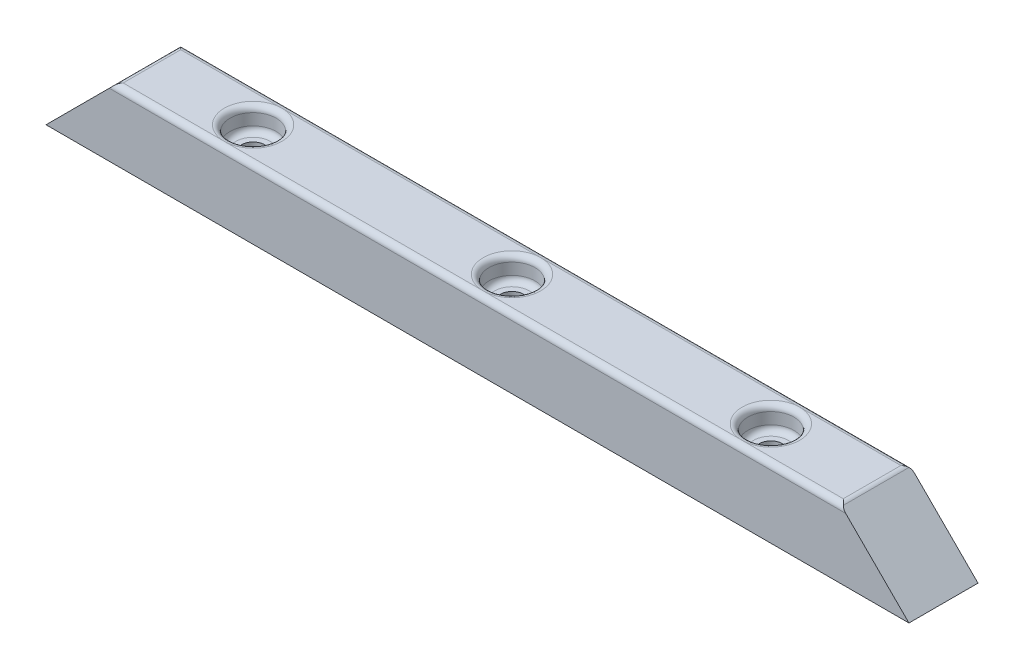
from build123d import *

# Parameters (mm, degrees)
BOSS_EXTRUDE1_DEPTH = 12
SKETCH3_R           = 2
CUT_EXTRUDE1_DEPTH  = 12
SKETCH4_R           = 4
CUT_EXTRUDE2_DEPTH  = 4
FILLET1_R           = 1
FILLET2_R           = 1
FILLET3_R           = 1


with BuildPart() as part:
    # Sketch2 → Boss-Extrude1 (new body)
    with BuildSketch(Plane.XY):
        Polygon((-75, -6), (-63, 6), (63, 6), (75, -6), align=None)
    extrude(amount=BOSS_EXTRUDE1_DEPTH)

    # Sketch3 → Cut-Extrude1 (cut)
    with BuildSketch(Plane(origin=(0, 6, 0), x_dir=(1, 0, 0), z_dir=(0, 1, 0))):
        with Locations(Location((0, -6, 0), (0, 0, 180))):
            Circle(SKETCH3_R)
        with Locations(Location((45, -6, 0), (0, 0, 180))):
            Circle(SKETCH3_R)
        with Locations(Location((-45, -6, 0), (0, 0, 180))):
            Circle(SKETCH3_R)
    extrude(amount=-CUT_EXTRUDE1_DEPTH, mode=Mode.SUBTRACT)

    # Sketch4 → Cut-Extrude2 (cut)
    with BuildSketch(Plane(origin=(0, 6, 0), x_dir=(1, 0, 0), z_dir=(0, 1, 0))):
        with Locations(Location((-45, -6, 0), (0, 0, 180))):
            Circle(SKETCH4_R)
        with Locations(Location((0, -6, 0), (0, 0, 180))):
            Circle(SKETCH4_R)
        with Locations(Location((45, -6, 0), (0, 0, 180))):
            Circle(SKETCH4_R)
    extrude(amount=-CUT_EXTRUDE2_DEPTH, mode=Mode.SUBTRACT)

    # Fillet1
    fillet1_edges = [part.edges().sort_by_distance(p)[0] for p in [
        (-41, 6, 6),
        (4, 6, 6),
        (49, 6, 6),
    ]]
    fillet(fillet1_edges, radius=FILLET1_R)

    # Fillet2
    fillet2_edges = [part.edges().sort_by_distance(p)[0] for p in [
        (-41, 2, 6),
        (4, 2, 6),
        (49, 2, 6),
    ]]
    fillet(fillet2_edges, radius=FILLET2_R)

    # Fillet3
    fillet3_edges = [part.edges().sort_by_distance(p)[0] for p in [
        (0, 6, 12),
        (0, 6, 0),
        (-63, 6, 6),
        (63, 6, 6),
    ]]
    fillet(fillet3_edges, radius=FILLET3_R - 0.0001)  # a hair under: the kernel refuses the full size


solid = part.part
